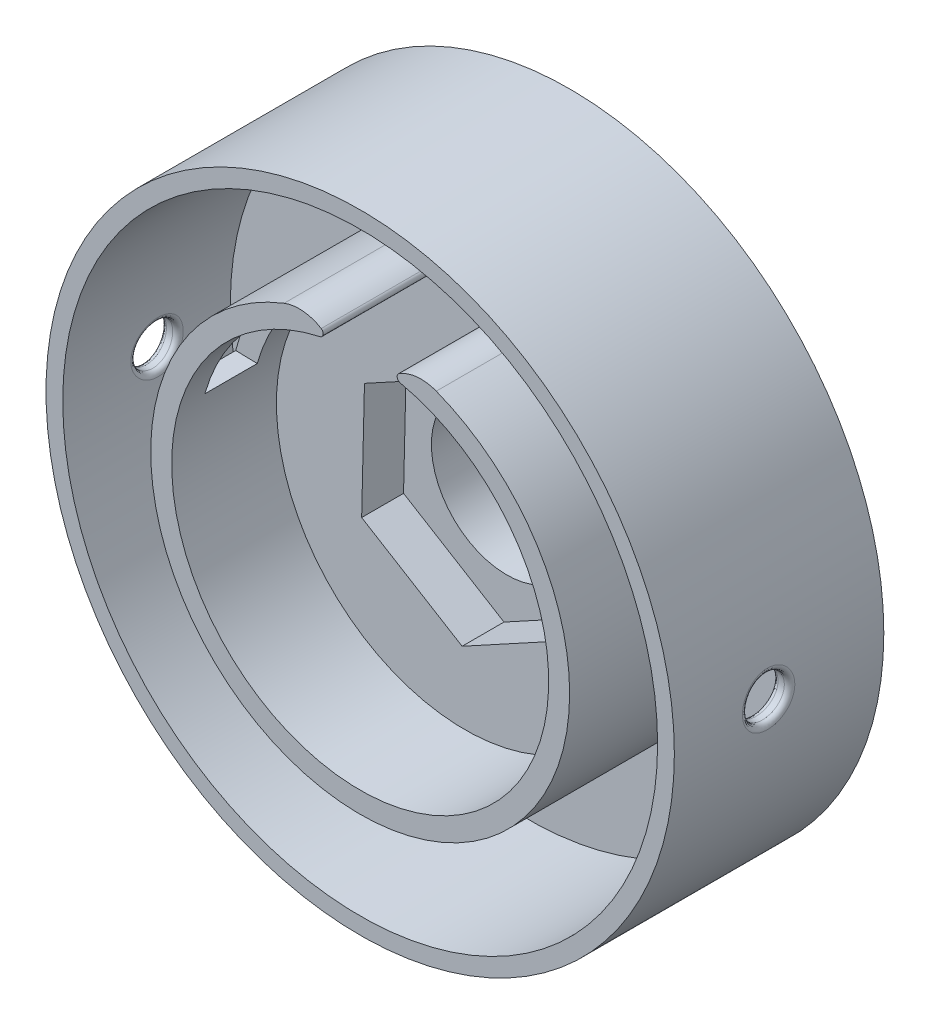
from build123d import *

# Parameters (mm, degrees)
SKETCH1_R                = 15
BOSS_EXTRUDE1_DEPTH      = 10
SKETCH2_R                = 3.6
CUT_EXTRUDE1_DEPTH       = 24.452078799
SKETCH3_R                = 9
CUT_EXTRUDE2_DEPTH       = 5
CUT_EXTRUDE3_DEPTH       = 2
SKETCH5_R                = 14.2
SKETCH5_R_2              = 10
CUT_EXTRUDE4_DEPTH       = 8
SKETCH7_W                = 3
SKETCH7_H                = 3.361478456
CUT_EXTRUDE6_DEPTH       = 5
FILLET2_R                = 2
FILLET3_R                = 0.2
SKETCH8_W                = 4.4
SKETCH8_H                = 2.4
CUT_EXTRUDE7_DEPTH       = 3
SKETCH9_W                = 2.5
SKETCH9_H                = 4
CUT_EXTRUDE8_DEPTH       = 15
CUT_EXTRUDE9_REACH       = 37
CUT_EXTRUDE9_END_RADIUS  = 14.2
SKETCH10_R               = 1
FILLET6_R                = 0.25
CUT_EXTRUDE11_REACH      = 37
CUT_EXTRUDE11_END_RADIUS = 14.2
SKETCH12_R               = 1
FILLET7_R                = 0.25


with BuildPart() as part:
    # Sketch1 → Boss-Extrude1 (new body)
    with BuildSketch(Plane.XY):
        Circle(SKETCH1_R)
    extrude(amount=BOSS_EXTRUDE1_DEPTH)

    # Sketch2 → Cut-Extrude1 (cut, through all)
    with BuildSketch(Plane.XY.offset(10)):
        Circle(SKETCH2_R)
    extrude(amount=-CUT_EXTRUDE1_DEPTH, mode=Mode.SUBTRACT)

    # Sketch3 → Cut-Extrude2 (cut)
    with BuildSketch(Plane.XY.offset(10)):
        Circle(SKETCH3_R)
    extrude(amount=-CUT_EXTRUDE2_DEPTH, mode=Mode.SUBTRACT)

    # Sketch4 → Cut-Extrude3 (cut)
    with BuildSketch(Plane.XY.offset(5)):
        Polygon((4.795841849, -2.923358252), (4.929623435, 2.691641748), (0.133781586, 5.615), (-4.795841849, 2.923358252), (-4.929623435, -2.691641748), (-0.133781586, -5.615), align=None)
    extrude(amount=-CUT_EXTRUDE3_DEPTH, mode=Mode.SUBTRACT)

    # Sketch5 → Cut-Extrude4 (cut)
    with BuildSketch(Plane.XY.offset(10)):
        Circle(SKETCH5_R)
        Circle(SKETCH5_R_2, mode=Mode.SUBTRACT)
    extrude(amount=-CUT_EXTRUDE4_DEPTH, mode=Mode.SUBTRACT)

    # Sketch7 → Cut-Extrude6 (cut)
    with BuildSketch(Plane.XY.offset(10)):
        with Locations((0, 10.554858903)):
            Rectangle(SKETCH7_W, SKETCH7_H)
    extrude(amount=-CUT_EXTRUDE6_DEPTH, mode=Mode.SUBTRACT)

    # Fillet2
    # the kernel refuses this fillet: 2 mm, written as the material it takes off along each edge
    with BuildSketch(Plane(origin=(-1.5, 9.886859967, 5), x_dir=(-0.9660683179575952, -0.2582866722047086, 0), z_dir=(0, 0, 1))) as fillet2_piece_1:
        with BuildLine():
            CenterArc((1.988175028, 1.987762437), FILLET2_R, 210.310979349, 66.030517682)
            Line((0.26157732, 0.97837631), (0.227045366, 0.958188588))
            ThreePointArc((0.227045366, 0.958188588), (0.092145927, 0.499519622), (-0.038642733, 0.010331467))
            Line((-0.038642733, 0.010331467), (-0.004418167, -0.039755249))
            ThreePointArc((-0.004418167, -0.039755249), (1.104541682, -0.101187814), (2.213501532, -0.039755249))
            Line((2.213501532, -0.039755249), (2.209083365, 0))
        make_face()
    extrude(amount=10.522708412, mode=Mode.SUBTRACT)
    with BuildSketch(Plane(origin=(1.5, 9.886859967, 5), x_dir=(0.9660683179575953, -0.25828667220470874, 0), z_dir=(0, 0, 1))) as fillet2_piece_2:
        with BuildLine():
            CenterArc((1.988175028, -1.987762437), FILLET2_R, 83.658502968, 66.030517682)
            Line((0.26157732, -0.97837631), (0.227045366, -0.958188588))
            ThreePointArc((0.227045366, -0.958188588), (0.092145927, -0.499519622), (-0.038642733, -0.010331467))
            Line((-0.038642733, -0.010331467), (-0.004418167, 0.039755249))
            ThreePointArc((-0.004418167, 0.039755249), (1.104541682, 0.101187814), (2.213501532, 0.039755249))
            Line((2.213501532, 0.039755249), (2.209083365, 0))
        make_face()
    extrude(amount=10.522708412, mode=Mode.SUBTRACT)

    # Fillet3
    fillet3_edges = [part.edges().sort_by_distance(p)[0] for p in [
        (-1.5, 8.874119675, 7.5),
        (1.5, 8.874119675, 7.5),
    ]]
    fillet(fillet3_edges, radius=FILLET3_R)

    # Sketch8 → Cut-Extrude7 (cut)
    with BuildSketch(Plane(origin=(0, 0, 0), x_dir=(-1, 0, 0), z_dir=(0, 0, -1))):
        with Locations((0, -7.15)):
            Rectangle(SKETCH8_W, SKETCH8_H)
    extrude(amount=-CUT_EXTRUDE7_DEPTH, mode=Mode.SUBTRACT)

    # Sketch9 → Cut-Extrude8 (cut)
    with BuildSketch(Plane(origin=(4.862732642, -0.115858252, 0), x_dir=(0, 0, 1), z_dir=(-0.999716287603517, 0.02381899032793182, 0))):
        with Locations((7.5, 4.227078832)):
            Rectangle(SKETCH9_W, SKETCH9_H)
    extrude(amount=CUT_EXTRUDE8_DEPTH, mode=Mode.SUBTRACT)

    # Cut-Extrude9: up to this cylinder (the profile starts outside it)
    cut_extrude9_end = Plane(origin=(0, 0, 5.5), z_dir=(0, 0, 1)) * Cylinder(CUT_EXTRUDE9_END_RADIUS, 103.4, mode=Mode.PRIVATE)
    # Sketch10 → Cut-Extrude9 (cut, up to the surface)
    with BuildSketch(Plane(origin=(15, 0, 0), x_dir=(0, 0, -1), z_dir=(1, 0, 0)), mode=Mode.PRIVATE) as cut_extrude9_sk1:
        with Locations((-5.5, 0)):
            Circle(SKETCH10_R)
    cut_extrude9_tool1 = extrude(cut_extrude9_sk1.sketch, amount=-CUT_EXTRUDE9_REACH, mode=Mode.PRIVATE) - cut_extrude9_end
    add(cut_extrude9_tool1.solids().sort_by_distance((15, 0, 5.5))[0], mode=Mode.SUBTRACT)

    # Fillet6
    fillet6_edges = [part.edges().sort_by_distance(p)[0] for p in [
        (14.164744968, 1, 5.5),
        (14.966629547, -1, 5.5),
    ]]
    fillet(fillet6_edges, radius=FILLET6_R)

    # Cut-Extrude11: up to this cylinder (the profile starts outside it)
    cut_extrude11_end = Plane(origin=(0, 0, 5.5), z_dir=(0, 0, 1)) * Cylinder(CUT_EXTRUDE11_END_RADIUS, 103.4, mode=Mode.PRIVATE)
    # Sketch12 → Cut-Extrude11 (cut, up to the surface)
    with BuildSketch(Plane(origin=(-15, 0, 0), x_dir=(0, 0, -1), z_dir=(1, 0, 0)), mode=Mode.PRIVATE) as cut_extrude11_sk1:
        with Locations(Location((-5.5, 0, 0), (0, 0, 347.655759474))):
            Circle(SKETCH12_R)
    cut_extrude11_tool1 = extrude(cut_extrude11_sk1.sketch, amount=CUT_EXTRUDE11_REACH, mode=Mode.PRIVATE) - cut_extrude11_end
    add(cut_extrude11_tool1.solids().sort_by_distance((-15, 0, 5.5))[0], mode=Mode.SUBTRACT)

    # Fillet7
    fillet7_edges = [part.edges().sort_by_distance(p)[0] for p in [
        (-14.198390607, 0.213784745, 6.476880801),
        (-14.998476451, 0.213784745, 6.476880801),
    ]]
    fillet(fillet7_edges, radius=FILLET7_R)


solid = part.part
